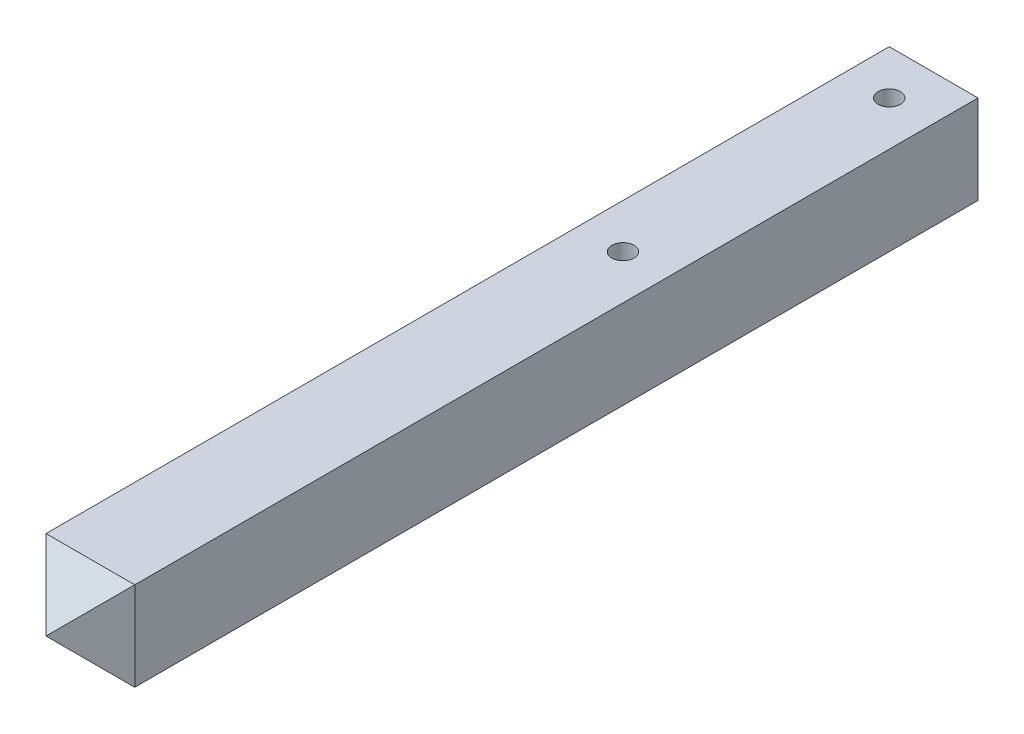
from build123d import *

# Parameters (mm, degrees)
SKETCH1_W           = 20
SKETCH1_H           = 200
SKETCH1_R           = 2.5
BOSS_EXTRUDE1_DEPTH = 20
CHAMFER1_SIZE       = 10
SCALE1_SCALE        = 7.5


with BuildPart() as part:
    # Sketch1 → Boss-Extrude1 (new body)
    with BuildSketch(Plane(origin=(0, 0, 0), x_dir=(1, 0, 0), z_dir=(0, 1, 0))):
        with Locations((10, -100)):
            Rectangle(SKETCH1_W, SKETCH1_H)
        with Locations(Location((10, -10, 0), (0, 0, 270))):
            Circle(SKETCH1_R, mode=Mode.SUBTRACT)
        with Locations(Location((10, -70, 0), (0, 0, 270))):
            Circle(SKETCH1_R, mode=Mode.SUBTRACT)
    extrude(amount=BOSS_EXTRUDE1_DEPTH)

    # Chamfer1
    chamfer1_edges = [part.edges().sort_by_distance(p)[0] for p in [
        (10, 0, 200),
        (10, 20, 200),
        (20, 10, 200),
        (0, 10, 200),
    ]]
    chamfer(chamfer1_edges, length=CHAMFER1_SIZE - 0.0001)  # a hair under: the kernel refuses the full size


with BuildPart() as part_1:
    # Scale1: scaled about (10, 10, 97.262644204)
    add(part.part.scale(SCALE1_SCALE).moved(Location((-65, -65, -632.207187326))))


solid = part_1.part
